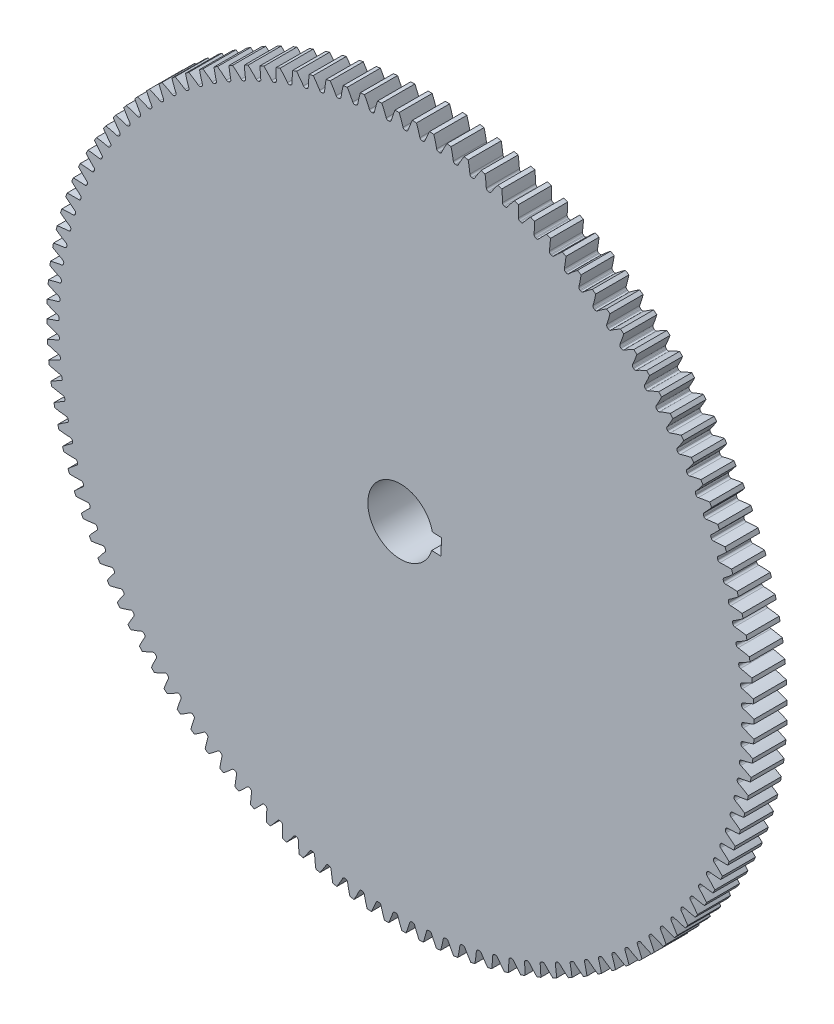
from build123d import *

# Parameters (mm, degrees)
SKETCH3_R         = 51.59375
GEARBODY_DEPTH    = 4.825999939
TOOTHCUT_DEPTH    = 74.124006684
CIRPATTERN1_COUNT = 128
HUB1DIA_R         = 23.875999939
HUB1_DEPTH        = 12.7
BOREDIA_R         = 4.7625
BORE_DEPTH        = 12700
KWY1_DEPTH        = 6350


with BuildPart() as part:
    # Sketch3 → gearBody (new body)
    with BuildSketch(Plane.XY):
        Circle(SKETCH3_R)
    extrude(amount=GEARBODY_DEPTH)

    # Sketch2 → toothCut (cut, through all)
    with BuildSketch(Plane.XY):
        with BuildLine():
            ThreePointArc((49.790308932, -0.79778905), (49.791198399, -0.740197859), (49.792021252, -0.682605677))
            ThreePointArc((49.792021252, -0.682605677), (49.85511974, -0.496096607), (50.01542023, -0.381768986))
            ThreePointArc((50.01542023, -0.381768986), (55.780492324, 2.570786737), (60.26561802, 7.243825258))
            ThreePointArc((60.26561802, 7.243825258), (60.692698462, -0.902259975), (60.023660232, -9.032050266))
            ThreePointArc((60.023660232, -9.032050266), (55.679424955, -4.227754127), (50.004666667, -1.105133449))
            ThreePointArc((50.004666667, -1.105133449), (49.84783546, -0.986091336), (49.790308932, -0.79778905))
        make_face()
    toothcut = extrude(amount=TOOTHCUT_DEPTH, mode=Mode.SUBTRACT)

    # CirPattern1: toothCut ×128 about axis
    cirpattern1_axis = Axis((0, 0, 4.825999939), (0, 0, -1))
    for i in range(1, CIRPATTERN1_COUNT):
        add(toothcut.rotate(cirpattern1_axis, i * 360 / CIRPATTERN1_COUNT), mode=Mode.SUBTRACT)

    # hub1Dia → hub1 (add)
    with BuildSketch(Plane(origin=(0, 0, 0), x_dir=(-1, 0, 0), z_dir=(0, 0, -1))):
        Circle(HUB1DIA_R)
    extrude(amount=HUB1_DEPTH)

    # boreDia → bore (cut, symmetric)
    with BuildSketch(Plane.XY):
        Circle(BOREDIA_R)
    extrude(amount=BORE_DEPTH, both=True, mode=Mode.SUBTRACT)

    # kwy1sketch → kwy1 (cut, symmetric)
    with BuildSketch(Plane.XY):
        Polygon((5.993533104, 0.955866333), (5.899665541, -1.424803853), (2.923827809, -1.307469399), (0, 0), (3.017695372, 1.073200787), align=None)
    extrude(amount=KWY1_DEPTH, both=True, mode=Mode.SUBTRACT)


solid = part.part
